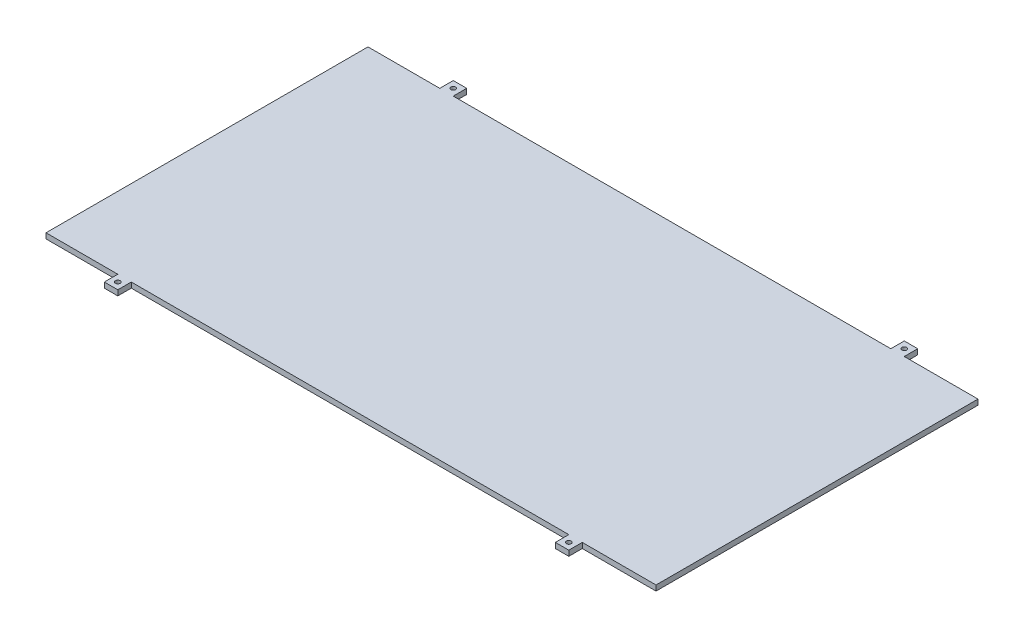
from build123d import *

# Parameters (mm, degrees)
SKETCH1_W           = 543.73
SKETCH1_H           = 4.7625
BOSS_EXTRUDE1_DEPTH = 287
CUT_EXTRUDE1_DEPTH  = 1.3
SKETCH2_W           = 12
SKETCH2_H           = 12
SKETCH2_R           = 2.1
BOSS_EXTRUDE2_DEPTH = 4.7625


with BuildPart() as part:
    # Sketch1 → Boss-Extrude1 (new body)
    with BuildSketch(Plane.XY):
        with Locations((-308.730031966, 2.060431686)):
            Rectangle(SKETCH1_W, SKETCH1_H)
    extrude(amount=BOSS_EXTRUDE1_DEPTH)

    # GasketGroove → Cut-Extrude1 (cut)
    with BuildSketch(Plane.XZ.offset(0.320818314)):
        with BuildLine():
            Line((-37.865031966, 2), (-37.865031966, 285))
            ThreePointArc((-37.865031966, 285), (-38.157925185, 285.707106781), (-38.865031966, 286))
            Line((-38.865031966, 286), (-578.595031966, 286))
            ThreePointArc((-578.595031966, 286), (-579.302138747, 285.707106781), (-579.595031966, 285))
            Line((-579.595031966, 285), (-579.595031966, 2))
            ThreePointArc((-579.595031966, 2), (-579.302138747, 1.292893219), (-578.595031966, 1))
            Line((-578.595031966, 1), (-38.865031966, 1))
            ThreePointArc((-38.865031966, 1), (-38.157925185, 1.292893219), (-37.865031966, 2))
        make_face()
        with BuildLine():
            Line((-577.595031966, 283), (-577.595031966, 4))
            ThreePointArc((-577.595031966, 4), (-577.302138747, 3.292893219), (-576.595031966, 3))
            Line((-576.595031966, 3), (-40.865031966, 3))
            ThreePointArc((-40.865031966, 3), (-40.157925185, 3.292893219), (-39.865031966, 4))
            Line((-39.865031966, 4), (-39.865031966, 283))
            ThreePointArc((-39.865031966, 283), (-40.157925185, 283.707106781), (-40.865031966, 284))
            Line((-40.865031966, 284), (-576.595031966, 284))
            ThreePointArc((-576.595031966, 284), (-577.302138747, 283.707106781), (-577.595031966, 283))
        make_face(mode=Mode.SUBTRACT)
    extrude(amount=-CUT_EXTRUDE1_DEPTH, mode=Mode.SUBTRACT)

    # Sketch2 → Boss-Extrude2 (add)
    # profile 1 of 4: a face of its own
    with BuildSketch(Plane(origin=(0, 4.441681686, 0), x_dir=(1, 0, 0), z_dir=(0, 1, 0))):
        with Locations((-510.595031966, -293)):
            Rectangle(SKETCH2_W, SKETCH2_H)
        with Locations((-510.595031966, -293)):
            Circle(SKETCH2_R, mode=Mode.SUBTRACT)
    # profile 2 of 4: a face of its own
    with BuildSketch(Plane(origin=(0, 4.441681686, 0), x_dir=(1, 0, 0), z_dir=(0, 1, 0))):
        with Locations((-108.595031966, -293)):
            Rectangle(SKETCH2_W, SKETCH2_H)
        with Locations((-108.595031966, -293)):
            Circle(SKETCH2_R, mode=Mode.SUBTRACT)
    # profile 3 of 4: a face of its own
    with BuildSketch(Plane(origin=(0, 4.441681686, 0), x_dir=(1, 0, 0), z_dir=(0, 1, 0))):
        with Locations((-510.595031966, 6)):
            Rectangle(SKETCH2_W, SKETCH2_H)
        with Locations((-510.595031966, 6)):
            Circle(SKETCH2_R, mode=Mode.SUBTRACT)
    # profile 4 of 4: a face of its own
    with BuildSketch(Plane(origin=(0, 4.441681686, 0), x_dir=(1, 0, 0), z_dir=(0, 1, 0))):
        with Locations((-108.595031966, 6)):
            Rectangle(SKETCH2_W, SKETCH2_H)
        with Locations((-108.595031966, 6)):
            Circle(SKETCH2_R, mode=Mode.SUBTRACT)
    extrude(amount=-BOSS_EXTRUDE2_DEPTH)


solid = part.part
